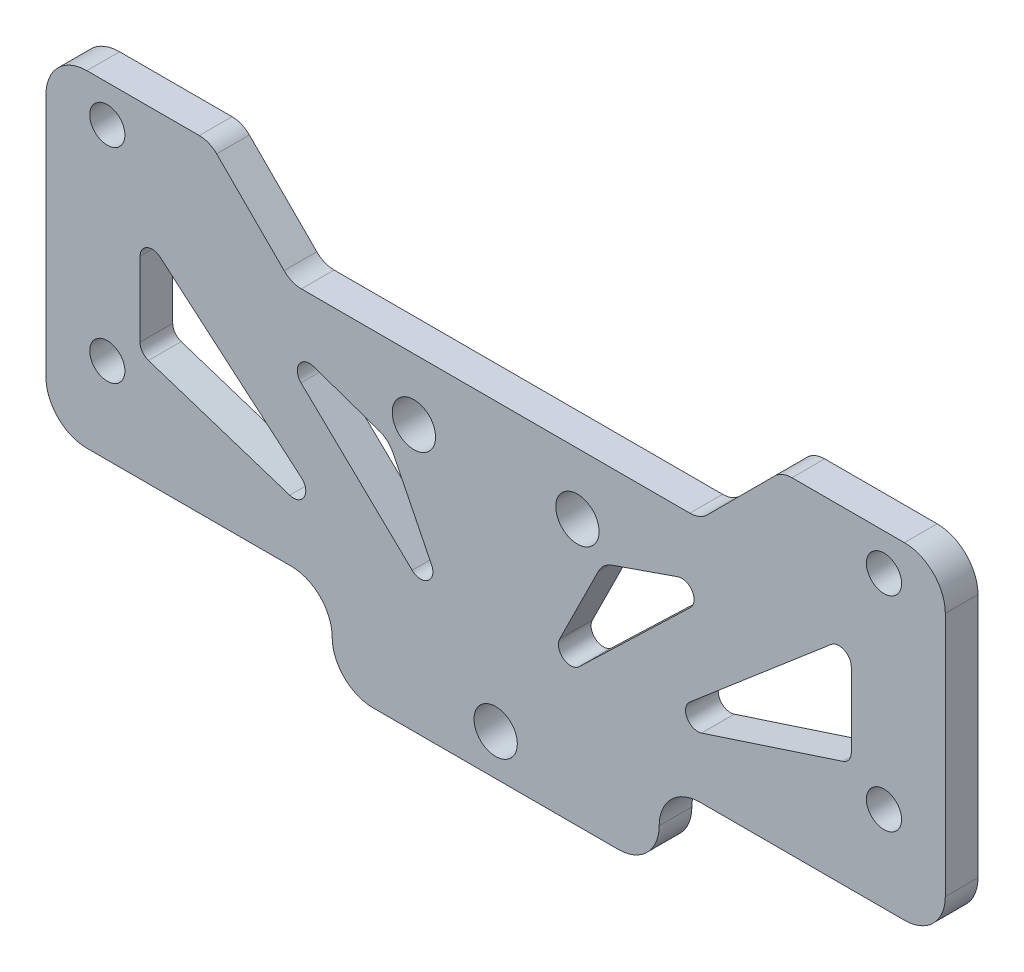
from build123d import *

# Parameters (mm, degrees)
SKETCH_1_R               = 2.65
SKETCH_1_R_2             = 2.15
EXTRUDE_1_DEPTH          = 4
FILLET_1_R               = 5
CUT_EXTRUDE_1_DEPTH      = 73.782209365
FILLET_2_R               = 3
CUT_EXTRUDE_2_DEPTH      = 73.782209365
CUT_EXTRUDE_2_DEPTH_BACK = 73.782209365
FILLET_4_R               = 1.5
FILLET_6_R               = 3


with BuildPart() as part:
    # 草图1 → 凸台-拉伸1 (new body)
    with BuildSketch(Plane.XY):
        Polygon((-45, 17.5), (65, 17.5), (65, -22.5), (30, -22.5), (30, -32.5), (-10, -32.5), (-10, -22.5), (-45, -22.5), align=None)
        with Locations((20, 0)):
            Circle(SKETCH_1_R, mode=Mode.SUBTRACT)
        Circle(SKETCH_1_R, mode=Mode.SUBTRACT)
        with Locations((57.5, 13)):
            Circle(SKETCH_1_R_2, mode=Mode.SUBTRACT)
        with Locations((57.5, -12)):
            Circle(SKETCH_1_R_2, mode=Mode.SUBTRACT)
        with Locations(Location((-37.5, -12, 0), (0, 0, 180))):
            Circle(SKETCH_1_R_2, mode=Mode.SUBTRACT)
        with Locations(Location((-37.5, 13, 0), (0, 0, 180))):
            Circle(SKETCH_1_R_2, mode=Mode.SUBTRACT)
        with Locations((10, -27.5)):
            Circle(SKETCH_1_R, mode=Mode.SUBTRACT)
    extrude(amount=EXTRUDE_1_DEPTH)

    # 圆角1
    fillet_1_edges = [part.edges().sort_by_distance(p)[0] for p in [
        (30, -22.5, 2),
        (-45, 17.5, 2),
        (-45, -22.5, 2),
        (65, 17.5, 2),
        (65, -22.5, 2),
        (30, -32.5, 2),
        (-10, -32.5, 2),
        (-10, -22.5, 2),
    ]]
    fillet(fillet_1_edges, radius=FILLET_1_R - 0.0001)  # a hair under: the kernel refuses the full size

    # 草图3 → 切除-拉伸1 (cut, through all)
    with BuildSketch(Plane.XY.offset(4)):
        Polygon((-25, 17.5), (-15, 7.5), (35, 7.5), (45, 17.5), align=None)
    extrude(amount=-CUT_EXTRUDE_1_DEPTH, mode=Mode.SUBTRACT)

    # 圆角2
    fillet_2_edges = [part.edges().sort_by_distance(p)[0] for p in [
        (-25, 17.5, 2),
        (45, 17.5, 2),
        (35, 7.5, 2),
        (-15, 7.5, 2),
    ]]
    fillet(fillet_2_edges, radius=FILLET_2_R)

    # 草图4 → 切除-拉伸2 (cut, two sides: drawn at the far end of the back side and taken through both)
    with BuildSketch(Plane.XY.offset(4).offset(-CUT_EXTRUDE_2_DEPTH_BACK)):
        Polygon((38.743514733, 2.264213721), (23.108666515, -3.155866994), (14, -21.5), align=None)
        Polygon((27.981910241, -17.424640848), (53.5, -9.097685243), (53.5, 4.332888314), align=None)
        Polygon((-33.5, -9.097685243), (-33.5, 4.332888314), (-7.981910241, -17.424640848), align=None)
        Polygon((-18.743514733, 2.264213721), (-3.108666515, -3.155866994), (6, -21.5), align=None)
    extrude(amount=CUT_EXTRUDE_2_DEPTH + CUT_EXTRUDE_2_DEPTH_BACK, mode=Mode.SUBTRACT)

    # 圆角4
    fillet_4_edges = [part.edges().sort_by_distance(p)[0] for p in [
        (53.5, 4.332888314, 2),
        (53.5, -9.097685243, 2),
        (27.981910241, -17.424640848, 2),
        (-7.981910241, -17.424640848, 2),
        (-33.5, -9.097685243, 2),
        (-33.5, 4.332888314, 2),
        (38.743514733, 2.264213721, 2),
        (14, -21.5, 2),
        (-18.743514733, 2.264213721, 2),
        (6, -21.5, 2),
    ]]
    fillet(fillet_4_edges, radius=FILLET_4_R)

    # 圆角6
    fillet_6_edges = [part.edges().sort_by_distance(p)[0] for p in [
        (-3.108666515, -3.155866994, 2),
        (23.108666515, -3.155866994, 2),
    ]]
    fillet(fillet_6_edges, radius=FILLET_6_R)


solid = part.part
